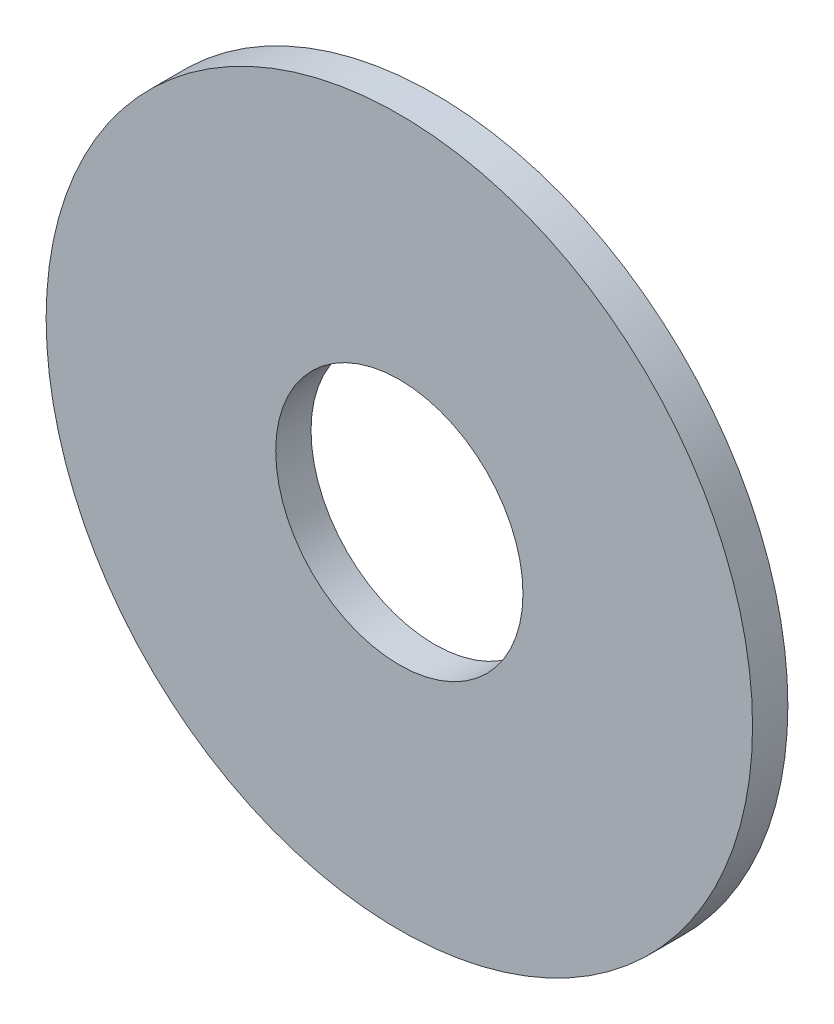
from build123d import *

# Parameters (mm, degrees)
SKETCH_1_R      = 10
SKETCH_1_R_2    = 3.5
EXTRUDE_1_DEPTH = 1


with BuildPart() as part:
    # Эскиз1 → Бобышка-Вытянуть1 (new body)
    with BuildSketch(Plane.XY):
        Circle(SKETCH_1_R)
        Circle(SKETCH_1_R_2, mode=Mode.SUBTRACT)
    extrude(amount=EXTRUDE_1_DEPTH)


solid = part.part
